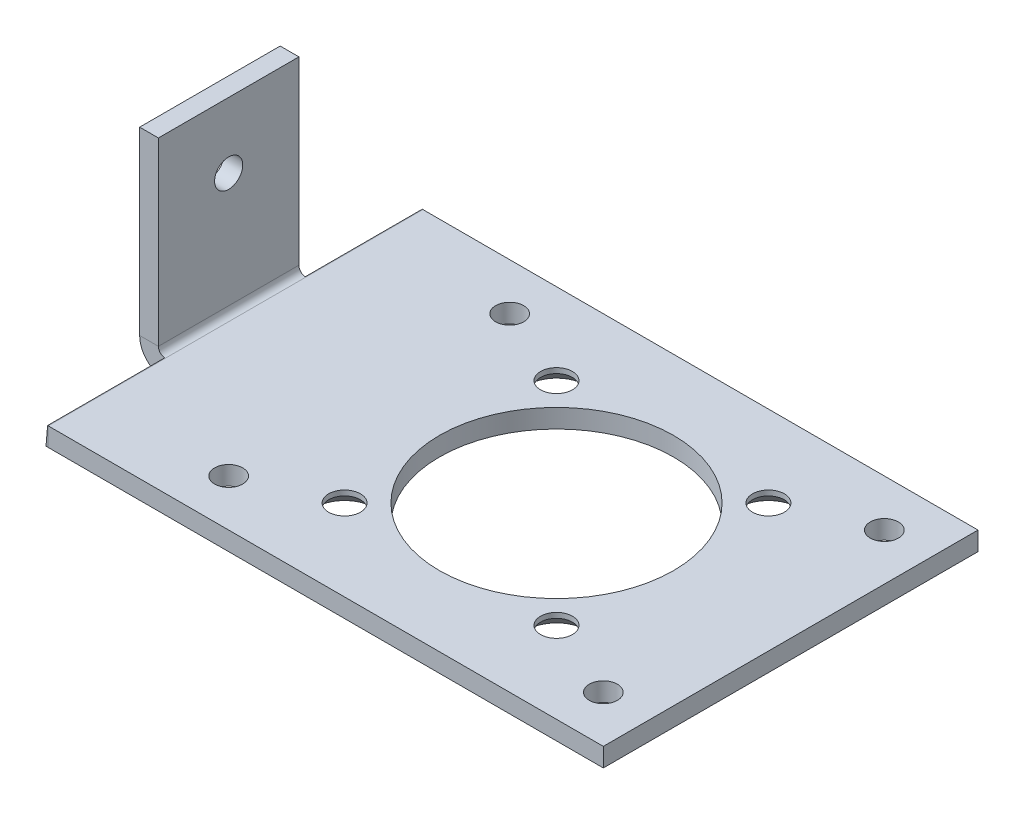
from build123d import *

# Parameters (mm, degrees)
SM_BASE_FLANGE_1_DEPTH       = 40
CUT_EXTRUDE_1_REACH          = 77.392
SKETCH_6_R                   = 12.5
HOLE_WIZARD_M3_2_D           = 3
HOLE_WIZARD_M3_4_D           = 3
HOLE_WIZARD_M3_1_D           = 3.4
HOLE_WIZARD_M3_1_CSINK_D     = 6.3
HOLE_WIZARD_M3_1_CSINK_ANGLE = 90
CUT_EXTRUDE_2_DEPTH          = 12.5
CUT_EXTRUDE_START            = 27.5
CUT_EXTRUDE_2_2_DEPTH        = 12.5


# Read off the part's stored shape, not the designer's step: 除料-伸長2
# Sheet-metal steps are written as plain solids
with BuildPart() as part:
    # Sketch 1 → 基材-凸緣1 (new body)
    with BuildSketch(Plane.XY):
        with BuildLine():
            Line((0, 20), (0, 0.7366))
            ThreePointArc((0, 0.7366), (0.215745145, 0.215745145), (0.7366, 0))
            Line((0.7366, 0), (60, 0))
            Line((60, 0), (60, -2))
            Line((60, -2), (0.7366, -2))
            ThreePointArc((0.7366, -2), (-1.198468417, -1.198468417), (-2, 0.7366))
            Line((-2, 0.7366), (-2, 20))
            Line((-2, 20), (0, 20))
        make_face()
    extrude(amount=SM_BASE_FLANGE_1_DEPTH)

    # 草圖6 → 除料-伸長1 (cut, up to next)
    with BuildSketch(Plane(origin=(0, -2, 0), x_dir=(-1, 0, 0), z_dir=(0, -1, 0)), mode=Mode.PRIVATE) as cut_extrude_1_sk1:
        with Locations(Location((-35, -20, 0), (0, 0, 90))):
            Circle(SKETCH_6_R)
    cut_extrude_1_tool1 = extrude(cut_extrude_1_sk1.sketch, amount=-CUT_EXTRUDE_1_REACH, mode=Mode.PRIVATE) & part.part
    add(cut_extrude_1_tool1.solids().sort_by_distance((35, -2, 20))[0], mode=Mode.SUBTRACT)

    # M3 螺紋孔2 (through all)
    with Locations(Plane.ZY.offset(2)):
        with Locations((20, 13)):
            Hole(HOLE_WIZARD_M3_2_D / 2)

    # M3 螺紋孔4 (through all)
    with Locations(Plane(origin=(0, -2, 0), x_dir=(-1, 0, 0), z_dir=(0, -1, 0))):
        with Locations((-15, -5), (-55, -5), (-55, -35), (-15, -35)):
            Hole(HOLE_WIZARD_M3_4_D / 2)

    # M3 平錐坑頭螺釘的錐孔1 (through all)
    with Locations(Plane(origin=(0, -2, 0), x_dir=(-1, 0, 0), z_dir=(0, -1, 0))):
        with Locations((-46.313708499, -8.686291501), (-46.313708499, -31.313708499), (-23.686291501, -31.313708499), (-23.686291501, -8.686291501)):
            CounterSinkHole(HOLE_WIZARD_M3_1_D / 2, HOLE_WIZARD_M3_1_CSINK_D / 2, counter_sink_angle=HOLE_WIZARD_M3_1_CSINK_ANGLE)

    # 除料-伸長2 outline → 除料-伸長2 (cut)
    with BuildSketch(Plane.XY):
        with BuildLine():
            Line((0.5, -1.989752875), (0.672915296, 0.002758179))
            ThreePointArc((0.672915296, 0.002758179), (0.193695905, 0.238770005), (0, 0.7366))
            Line((0, 0.7366), (0, 20))
            Line((0, 20), (-2, 20))
            Line((-2, 20), (-2, 0.7366))
            ThreePointArc((-2, 0.7366), (-1.280385265, -1.112926966), (0.5, -1.989752875))
        make_face()
    extrude(amount=CUT_EXTRUDE_2_DEPTH, mode=Mode.SUBTRACT)

    # Cut-Extrude 2 2 outline → Cut-Extrude 2 2 (cut)
    with BuildSketch(Plane.XY.offset(CUT_EXTRUDE_START)):
        with BuildLine():
            Line((0.5, -1.989752875), (0.672915296, 0.002758179))
            ThreePointArc((0.672915296, 0.002758179), (0.193695905, 0.238770005), (0, 0.7366))
            Line((0, 0.7366), (0, 20))
            Line((0, 20), (-2, 20))
            Line((-2, 20), (-2, 0.7366))
            ThreePointArc((-2, 0.7366), (-1.280385265, -1.112926966), (0.5, -1.989752875))
        make_face()
    extrude(amount=CUT_EXTRUDE_2_2_DEPTH, mode=Mode.SUBTRACT)


solid = part.part
